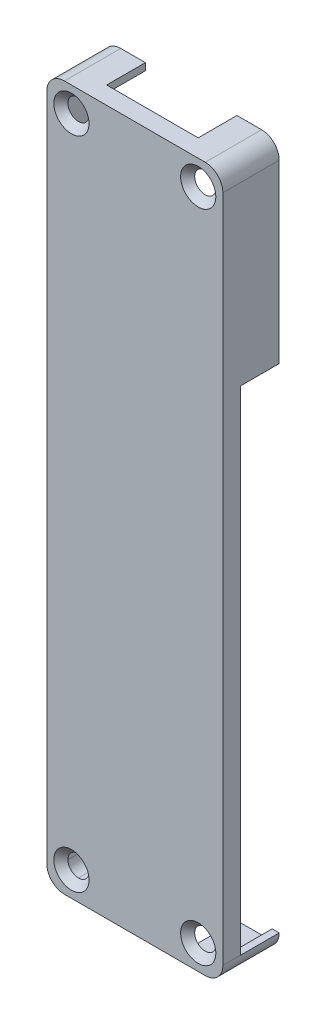
from build123d import *

# Parameters (mm, degrees)
SCHIZZO1_W                    = 50
SCHIZZO1_H                    = 200
ESTRUSIONE_ESTRUSIONE1_DEPTH  = 16
RACCORDO1_R                   = 5
SVUOTA1_T                     = -2
TAGLIO_ESTRUSIONE1_DEPTH      = 203.190504228
TAGLIO_ESTRUSIONE1_DEPTH_BACK = 203.190504228
SCHIZZO8_R                    = 3
TAGLIO_ESTRUSIONE2_DEPTH      = 105.312031904
SCHIZZO5_W                    = 11
SCHIZZO5_H                    = 140
TAGLIO_ESTRUSIONE3_DEPTH      = 7
SMUSSO1_SIZE                  = 2


with BuildPart() as part:
    # Schizzo1 → Estrusione-Estrusione1 (new body)
    with BuildSketch(Plane.XY):
        Rectangle(SCHIZZO1_W, SCHIZZO1_H)
    extrude(amount=ESTRUSIONE_ESTRUSIONE1_DEPTH)

    # Raccordo1
    raccordo1_edges = [part.edges().sort_by_distance(p)[0] for p in [
        (25, -100, 8),
        (-25, -100, 8),
        (-25, 100, 8),
        (25, 100, 8),
    ]]
    fillet(raccordo1_edges, radius=RACCORDO1_R)

    # Svuota1
    svuota1_openings = [part.faces().sort_by_distance(p)[0] for p in [
        (0, 0, 0),
    ]]
    offset(amount=SVUOTA1_T, openings=svuota1_openings, kind=Kind.INTERSECTION)

    # Schizzo4 → Taglio-Estrusione1 (cut, two sides: drawn at the far end of the back side and taken through both)
    with BuildSketch(Plane(origin=(0, 100, 0), x_dir=(1, 0, 0), z_dir=(0, 1, 0)).offset(-TAGLIO_ESTRUSIONE1_DEPTH_BACK)):
        Polygon((-13, 92.462112512), (-13, 0), (-13, -11), (13, -11), (13, 0), (13, 92.462112512), (13, 277.386337537), (-13, 277.386337537), align=None)
    extrude(amount=TAGLIO_ESTRUSIONE1_DEPTH + TAGLIO_ESTRUSIONE1_DEPTH_BACK, mode=Mode.SUBTRACT)

    # Schizzo8 → Taglio-Estrusione2 (cut, through all)
    with BuildSketch(Plane.XY.offset(16)):
        with Locations((-18, 93)):
            Circle(SCHIZZO8_R)
        with Locations((18, 93)):
            Circle(SCHIZZO8_R)
    taglio_estrusione2 = extrude(amount=-TAGLIO_ESTRUSIONE2_DEPTH, mode=Mode.SUBTRACT)

    # Specchia1: Taglio-Estrusione2 across plane
    add(taglio_estrusione2.mirror(Plane.ZX), mode=Mode.SUBTRACT)

    # Schizzo5 → Taglio-Estrusione3 (cut)
    with BuildSketch(Plane(origin=(25, 0, 0), x_dir=(0, 0, -1), z_dir=(1, 0, 0))):
        with Locations((-5.5, -25)):
            Rectangle(SCHIZZO5_W, SCHIZZO5_H)
    extrude(amount=-TAGLIO_ESTRUSIONE3_DEPTH, mode=Mode.SUBTRACT)

    # Smusso1
    smusso1_edges = [part.edges().sort_by_distance(p)[0] for p in [
        (15, -93, 16),
        (-21, 93, 16),
        (15, 93, 16),
        (-21, -93, 16),
    ]]
    chamfer(smusso1_edges, length=SMUSSO1_SIZE - 0.0001)  # a hair under: the kernel refuses the full size


solid = part.part
